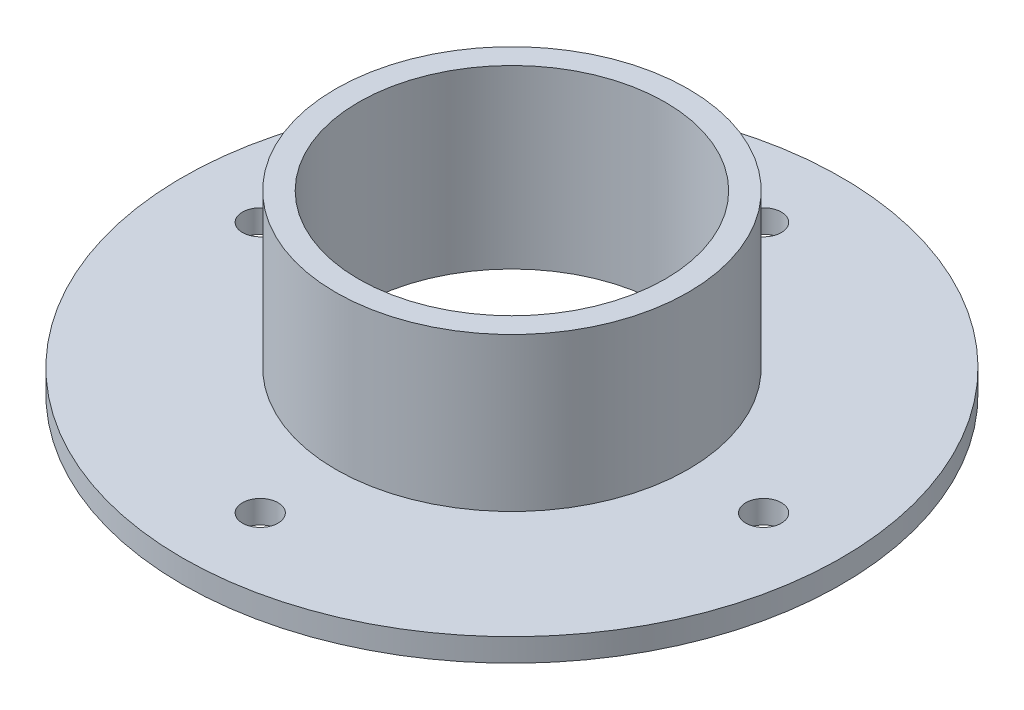
from build123d import *

# Parameters (mm, degrees)
SKETCH_1_R          = 43
EXTRUDE_1_DEPTH     = 3
SKETCH_2_R          = 23
SKETCH_2_R_2        = 20
EXTRUDE_2_DEPTH     = 20
CUT_EXTRUDE_START   = -20
SKETCH_3_R          = 20
SKETCH_3_R_2        = 2.320189094
CUT_EXTRUDE_1_DEPTH = 20


with BuildPart() as part:
    # 草图1 → 凸台-拉伸1 (new body)
    with BuildSketch(Plane(origin=(0, 0, 0), x_dir=(1, 0, 0), z_dir=(0, 1, 0))):
        Circle(SKETCH_1_R)
    extrude(amount=EXTRUDE_1_DEPTH)

    # 草图2 → 凸台-拉伸2 (add)
    with BuildSketch(Plane(origin=(0, 3, 0), x_dir=(1, 0, 0), z_dir=(0, 1, 0))):
        Circle(SKETCH_2_R)
        Circle(SKETCH_2_R_2, mode=Mode.SUBTRACT)
    extrude(amount=EXTRUDE_2_DEPTH)

    # 草图3 → 切除-拉伸1 (cut)
    with BuildSketch(Plane(origin=(0, 3, 0), x_dir=(1, 0, 0), z_dir=(0, 1, 0)).offset(CUT_EXTRUDE_START)):
        Circle(SKETCH_3_R)
        with Locations((0, 32.837689205)):
            Circle(SKETCH_3_R_2)
        with Locations((32.837689205, 0)):
            Circle(SKETCH_3_R_2)
        with Locations((0, -32.837689205)):
            Circle(SKETCH_3_R_2)
        with Locations((-32.837689205, 0)):
            Circle(SKETCH_3_R_2)
    extrude(amount=CUT_EXTRUDE_1_DEPTH, mode=Mode.SUBTRACT)


solid = part.part
